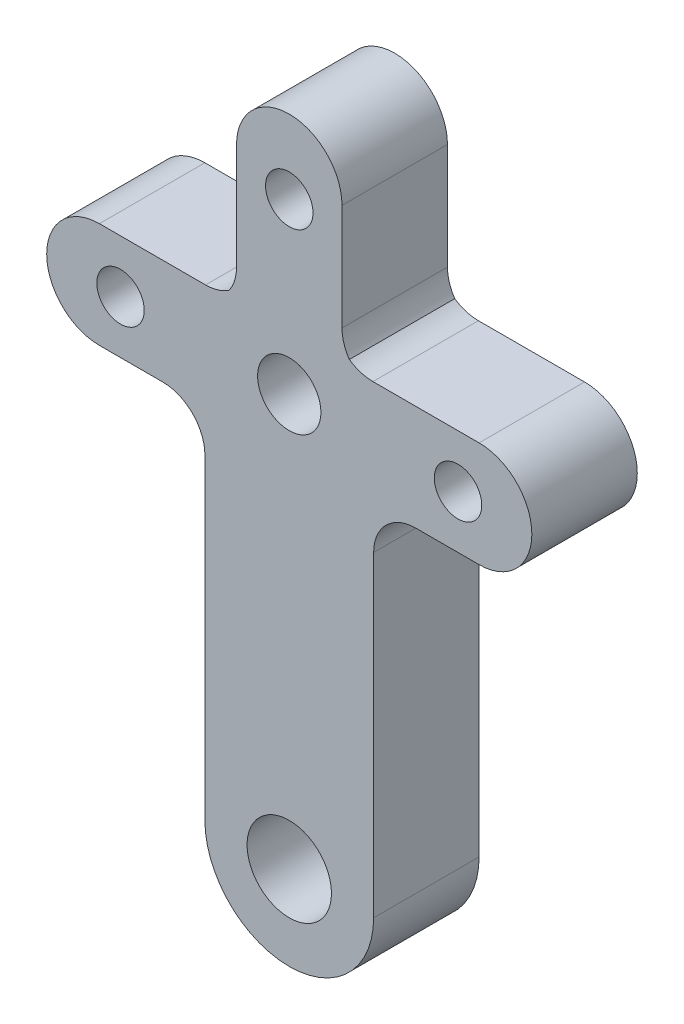
from build123d import *

# Parameters (mm, degrees)
ESQUISSE1_R             = 26.25
BOSS_EXTRU_1_DEPTH      = 5
ESQUISSE2_R             = 1.5
ENL_V_MAT_EXTRU_1_DEPTH = 5
ENL_V_START             = -5
ESQUISSE3_R             = 26.25
ESQUISSE3_R_2           = 2
ENL_V_MAT_EXTRU_2_DEPTH = 5
CONG_1_R                = 2
ESQUISSE4_R             = 1.125
ENL_V_MAT_EXTRU_3_DEPTH = 10


with BuildPart() as part:
    # Esquisse1 → Boss.-Extru.1 (new body)
    with BuildSketch(Plane.XY):
        Circle(ESQUISSE1_R)
    extrude(amount=BOSS_EXTRU_1_DEPTH)

    # Esquisse2 → Enlèv. mat.-Extru.1 (cut)
    with BuildSketch(Plane.XY.offset(5)):
        Circle(ESQUISSE2_R)
    extrude(amount=-ENL_V_MAT_EXTRU_1_DEPTH, mode=Mode.SUBTRACT)

    # Esquisse3 → Enlèv. mat.-Extru.2 (cut)
    # profile 1 of 2: a face of its own
    with BuildSketch(Plane.XY.offset(5).offset(ENL_V_START)):
        Circle(ESQUISSE3_R)
        with BuildLine():
            Line((9, -2.5), (4, -2.5))
            Line((4, -2.5), (4, -19.5))
            ThreePointArc((4, -19.5), (0, -23.5), (-4, -19.5))
            Line((-4, -19.5), (-4, -2.5))
            Line((-4, -2.5), (-9, -2.5))
            ThreePointArc((-9, -2.5), (-11.5, 0), (-9, 2.5))
            Line((-9, 2.5), (-3.122498999, 2.5))
            ThreePointArc((-3.122498999, 2.5), (-2.828427125, 2.828427125), (-2.5, 3.122498999))
            Line((-2.5, 3.122498999), (-2.5, 9))
            ThreePointArc((-2.5, 9), (0, 11.5), (2.5, 9))
            Line((2.5, 9), (2.5, 3.122498999))
            ThreePointArc((2.5, 3.122498999), (2.828427125, 2.828427125), (3.122498999, 2.5))
            Line((3.122498999, 2.5), (9, 2.5))
            ThreePointArc((9, 2.5), (11.5, 0), (9, -2.5))
        make_face(mode=Mode.SUBTRACT)
    # profile 2 of 2: a face of its own
    with BuildSketch(Plane.XY.offset(5).offset(ENL_V_START)):
        with Locations((0, -19.5)):
            Circle(ESQUISSE3_R_2)
    extrude(amount=ENL_V_MAT_EXTRU_2_DEPTH, mode=Mode.SUBTRACT)

    # Congé1
    # the kernel refuses this fillet: 2 mm, written as the material it adds along each edge
    with BuildSketch(Plane(origin=(-4, -2.5, 0), x_dir=(0, -1, 0), z_dir=(0, 0, 1)), Plane(origin=(4, -2.5, 0), x_dir=(1, 0, 0), z_dir=(0, 0, 1))) as cong_1_piece_1:
        with BuildLine():
            CenterArc((CONG_1_R, -CONG_1_R), CONG_1_R, 90, 90)
            Line((0, -CONG_1_R), (0, 0))
            Line((0, 0), (CONG_1_R, 0))
        make_face()
    extrude(amount=5)
    with BuildSketch(Plane(origin=(-3.122498999, 2.5, 0), x_dir=(-1, 0, 0), z_dir=(0, 0, 1))) as cong_1_piece_2:
        with BuildLine():
            CenterArc((0.846127967, -2), CONG_1_R, 90, 41.409622109)
            ThreePointArc((-0.476747688, -0.5), (-0.227558946, -0.260311955), (0, 0))
            Line((0, 0), (0.846127967, 0))
        make_face()
    extrude(amount=5)
    with BuildSketch(Plane(origin=(-2.5, 3.122498999, 0), x_dir=(-0.7237350132500174, -0.6900779887780779, 0), z_dir=(0, 0, 1)), Plane(origin=(3.122498999, 2.5, 0), x_dir=(-0.6900779887780603, 0.7237350132500343, 0), z_dir=(0, 0, 1))) as cong_1_piece_3:
        with BuildLine():
            CenterArc((0.863575741, -1.992528413), CONG_1_R, 94.954095219, 41.409622109)
            Line((-0.583894286, -0.612372436), (0, 0))
            ThreePointArc((0, 0), (0.345430296, -0.014943173), (0.690860592, 0))
        make_face()
    extrude(amount=5)
    with BuildSketch(Plane(origin=(2.5, 3.122498999, 0), x_dir=(0.7237350132500171, -0.6900779887780782, 0), z_dir=(0, 0, 1))) as cong_1_piece_4:
        with BuildLine():
            CenterArc((0.863575741, 1.992528413), CONG_1_R, 223.636282672, 41.409622109)
            Line((-0.583894286, 0.612372436), (0, 0))
            ThreePointArc((0, 0), (0.345430296, 0.014943173), (0.690860592, 0))
        make_face()
    extrude(amount=5)

    # Esquisse4 → Enlèv. mat.-Extru.3 (cut)
    with BuildSketch(Plane.XY.offset(5)):
        with Locations((-8, 0)):
            Circle(ESQUISSE4_R)
        with Locations((8, 0)):
            Circle(ESQUISSE4_R)
        with Locations((0, 8)):
            Circle(ESQUISSE4_R)
    extrude(amount=-ENL_V_MAT_EXTRU_3_DEPTH, mode=Mode.SUBTRACT)


solid = part.part
